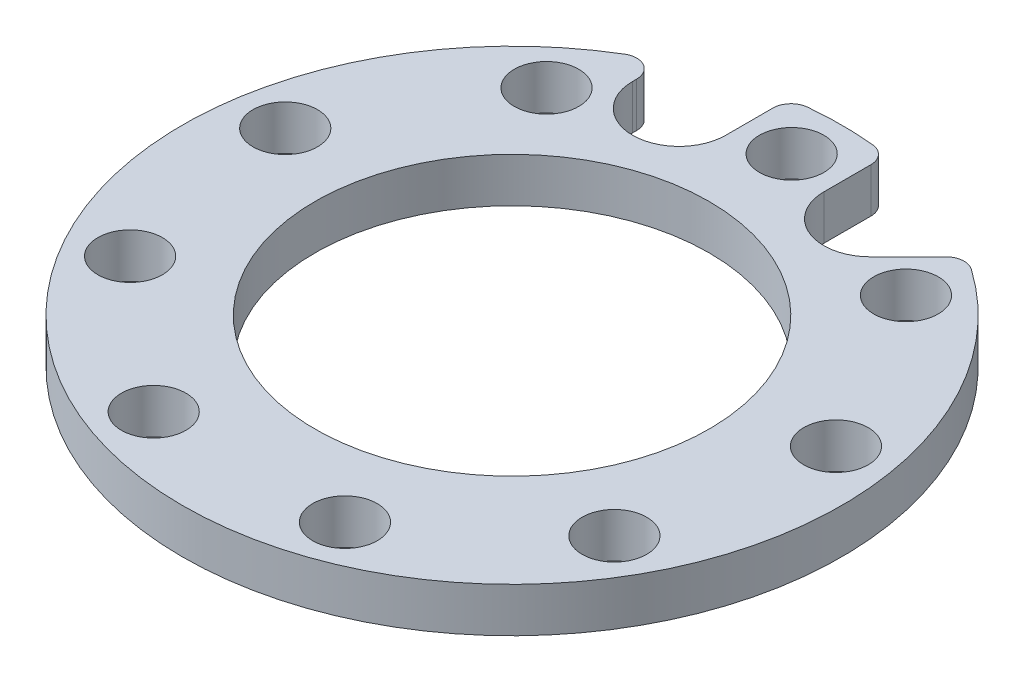
from build123d import *

# Parameters (mm, degrees)
SKETCH1_R            = 45.974
SKETCH1_R_2          = 27.4955
SKETCH1_R_3          = 6.5
BOSS_EXTRUDE1_DEPTH  = 6.21400078
M8_CLEARANCE_HOLE1_D = 9
CIRPATTERN1_COUNT    = 9
CUT_EXTRUDE1_DEPTH   = 66.313330628
FILLET1_R            = 2.54


with BuildPart() as part:
    # Sketch1 → Boss-Extrude1 (new body)
    with BuildSketch(Plane(origin=(0, 0, 0), x_dir=(1, 0, 0), z_dir=(0, 1, 0))):
        Circle(SKETCH1_R)
        Circle(SKETCH1_R_2, mode=Mode.SUBTRACT)
        with Locations((-13.33878559, 36.648012211)):
            Circle(SKETCH1_R_3, mode=Mode.SUBTRACT)
        with Locations((13.33878559, 36.648012211)):
            Circle(SKETCH1_R_3, mode=Mode.SUBTRACT)
    extrude(amount=BOSS_EXTRUDE1_DEPTH)

    # M8 Clearance Hole1 (through all)
    with Locations(Plane(origin=(0, 6.21400078, 0), x_dir=(1, 0, 0), z_dir=(0, 1, 0))):
        with Locations((0, 39)):
            m8_clearance_hole1 = Hole(M8_CLEARANCE_HOLE1_D / 2)

    # CirPattern1: M8 Clearance Hole1 ×9 about axis
    cirpattern1_axis = Axis((0, 6.21400078, 0), (0, -1, 0))
    for i in range(1, CIRPATTERN1_COUNT):
        add(m8_clearance_hole1.rotate(cirpattern1_axis, i * 360 / CIRPATTERN1_COUNT), mode=Mode.SUBTRACT)

    # Sketch6 → Cut-Extrude1 (cut, through all)
    with BuildSketch(Plane(origin=(0, 6.21400078, 0), x_dir=(1, 0, 0), z_dir=(0, 1, 0))):
        with BuildLine():
            Line((17.934979667, 32.051818133), (24.674577095, 38.79141556))
            ThreePointArc((24.674577095, 38.79141556), (16.105864692, 43.06053644), (6.83878559, 45.462508594))
            Line((6.83878559, 45.462508594), (6.83878559, 36.648012211))
            ThreePointArc((6.83878559, 36.648012211), (15.8262279, 42.653229172), (17.934979667, 32.051818133))
        make_face()
        with BuildLine():
            Line((-6.83878559, 36.648012211), (-6.83878559, 45.462508594))
            ThreePointArc((-6.83878559, 45.462508594), (-13.487094864, 43.951188245), (-19.83878559, 41.473259606))
            Line((-19.83878559, 41.473259606), (-19.83878559, 36.648012211))
            ThreePointArc((-19.83878559, 36.648012211), (-13.33878559, 43.148012211), (-6.83878559, 36.648012211))
        make_face()
    extrude(amount=-CUT_EXTRUDE1_DEPTH, mode=Mode.SUBTRACT)

    # Fillet1
    fillet1_edges = [part.edges().sort_by_distance(p)[0] for p in [
        (24.674577095, 3.10700039, -38.79141556),
        (6.83878559, 3.10700039, -45.462508594),
        (-6.83878559, 3.10700039, -45.462508594),
        (-19.83878559, 3.10700039, -41.473259606),
    ]]
    fillet(fillet1_edges, radius=FILLET1_R)


solid = part.part
